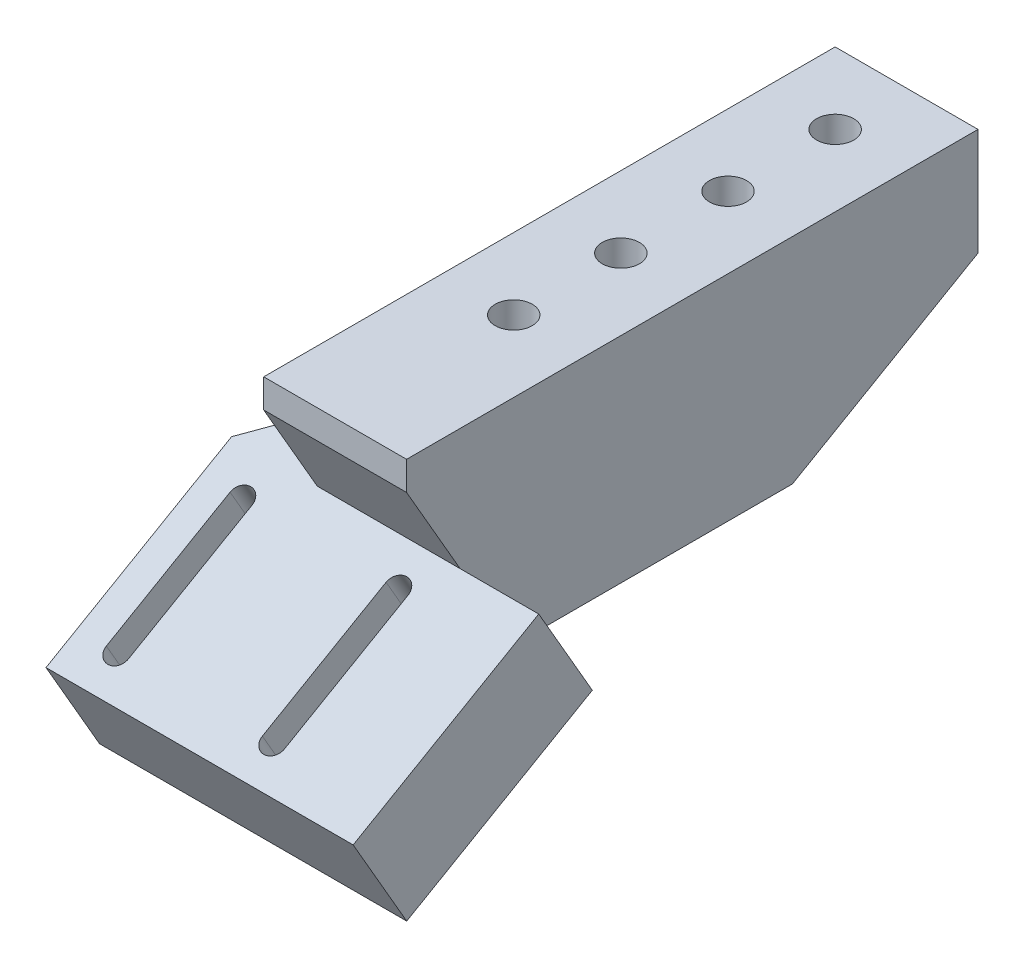
from build123d import *

# Parameters (mm, degrees)
SKETCH1_W           = 80
SKETCH1_H           = 30
BOSS_EXTRUDE1_DEPTH = 20
CHAMFER1_SIZE       = 15
CHAMFER1_SIZE2      = 25.980762114
SKETCH2_W           = 43
SKETCH2_H           = 15
BOSS_EXTRUDE2_DEPTH = 30
CUT_EXTRUDE1_REACH  = 75.891
CUT_EXTRUDE2_DEPTH  = 3
SKETCH5_W           = 12
SKETCH5_H           = 12
BOSS_EXTRUDE3_DEPTH = 15
CHAMFER2_SIZE       = 12
CUT_EXTRUDE3_REACH  = 75.103
SKETCH6_R           = 2.6
SKETCH7_R           = 5.5
CUT_EXTRUDE4_DEPTH  = 20
CHAMFER3_SIZE       = 15
CHAMFER3_SIZE_2     = 25.980762114


# Some blends are built 0.0001 mm under size
with BuildPart() as part:
    # Sketch1 → Boss-Extrude1 (new body)
    with BuildSketch(Plane(origin=(0, 0, 0), x_dir=(0, 0, -1), z_dir=(1, 0, 0))):
        Rectangle(SKETCH1_W, SKETCH1_H)
    extrude(amount=-BOSS_EXTRUDE1_DEPTH)

    # Chamfer1
    chamfer1_edges = [part.edges().sort_by_distance(p)[0] for p in [
        (-10, -15, 40),
    ]]
    chamfer1_side = [part.faces().sort_by_distance(p)[0] for p in [
        (-10, -15, 0),
    ]]
    chamfer(chamfer1_edges, length=CHAMFER1_SIZE, length2=CHAMFER1_SIZE2, reference=chamfer1_side[0])

    # Sketch2 → Boss-Extrude2 (add)
    with BuildSketch(Plane(origin=(0, -14.575317547, 25.245190528), x_dir=(1, 0, 0), z_dir=(0, -0.5000000000000012, 0.866025403784438))):
        with Locations((-10.5, 7.009618943)):
            Rectangle(SKETCH2_W, SKETCH2_H)
    extrude(amount=BOSS_EXTRUDE2_DEPTH)

    # Sketch3 → Cut-Extrude1 (cut, up to next)
    with BuildSketch(Plane(origin=(0, 12.565698604, 7.254809472), x_dir=(1, 0, 0), z_dir=(0, 0.8660254037844378, 0.5000000000000013)), mode=Mode.PRIVATE) as cut_extrude1_sk1:
        with BuildLine():
            Line((-24.78, -34.150635095), (-24.78, -54.150635095))
            ThreePointArc((-24.78, -54.150635095), (-26.33, -55.700635095), (-27.88, -54.150635095))
            Line((-27.88, -54.150635095), (-27.88, -34.150635095))
            ThreePointArc((-27.88, -34.150635095), (-26.33, -32.600635095), (-24.78, -34.150635095))
        make_face()
    cut_extrude1_tool1 = extrude(cut_extrude1_sk1.sketch, amount=-CUT_EXTRUDE1_REACH, mode=Mode.PRIVATE) & part.part
    # Sketch3 → Cut-Extrude1 (cut, up to next)
    with BuildSketch(Plane(origin=(0, 12.565698604, 7.254809472), x_dir=(1, 0, 0), z_dir=(0, 0.8660254037844378, 0.5000000000000013)), mode=Mode.PRIVATE) as cut_extrude1_sk2:
        with BuildLine():
            Line((-2.94, -34.150635095), (-2.94, -54.150635095))
            ThreePointArc((-2.94, -54.150635095), (-4.49, -55.700635095), (-6.04, -54.150635095))
            Line((-6.04, -54.150635095), (-6.04, -34.150635095))
            ThreePointArc((-6.04, -34.150635095), (-4.49, -32.600635095), (-2.94, -34.150635095))
        make_face()
    cut_extrude1_tool2 = extrude(cut_extrude1_sk2.sketch, amount=-CUT_EXTRUDE1_REACH, mode=Mode.PRIVATE) & part.part
    add(cut_extrude1_tool1.solids().sort_by_distance((-26.33, -9.509619, 45.490381))[0], mode=Mode.SUBTRACT)
    add(cut_extrude1_tool2.solids().sort_by_distance((-4.49, -9.509619, 45.490381))[0], mode=Mode.SUBTRACT)

    # Sketch4 → Cut-Extrude2 (cut)
    with BuildSketch(Plane(origin=(0, -0.424682453, -0.245190528), x_dir=(1, 0, 0), z_dir=(0, -0.8660254037844379, -0.5000000000000013))):
        with BuildLine():
            Line((-23.58, 54.150635095), (-23.58, 34.150635095))
            ThreePointArc((-23.58, 34.150635095), (-26.33, 31.400635095), (-29.08, 34.150635095))
            Line((-29.08, 34.150635095), (-29.08, 54.150635095))
            ThreePointArc((-29.08, 54.150635095), (-26.33, 56.900635095), (-23.58, 54.150635095))
        make_face()
        with BuildLine():
            Line((-1.74, 54.150635095), (-1.74, 34.150635095))
            ThreePointArc((-1.74, 34.150635095), (-4.49, 31.400635095), (-7.24, 34.150635095))
            Line((-7.24, 34.150635095), (-7.24, 54.150635095))
            ThreePointArc((-7.24, 54.150635095), (-4.49, 56.900635095), (-1.74, 54.150635095))
        make_face()
    extrude(amount=-CUT_EXTRUDE2_DEPTH, mode=Mode.SUBTRACT)

    # Sketch5 → Boss-Extrude3 (add)
    with BuildSketch(Plane(origin=(0, 12.565698604, 7.254809472), x_dir=(1, 0, 0), z_dir=(0, 0.8660254037844378, 0.5000000000000013))):
        with Locations((-26, -23.150635095)):
            Rectangle(SKETCH5_W, SKETCH5_H)
    extrude(amount=-BOSS_EXTRUDE3_DEPTH)

    # Chamfer2
    chamfer2_edges = [part.edges().sort_by_distance(p)[0] for p in [
        (-32, -2.504809472, 18.357695155),
    ]]
    chamfer(chamfer2_edges, length=CHAMFER2_SIZE - 0.0001)  # a hair under: the kernel refuses the full size

    # Sketch6 → Cut-Extrude3 (cut, up to next)
    with BuildSketch(Plane.XZ.offset(15), mode=Mode.PRIVATE) as cut_extrude3_sk1:
        with Locations(Location((-10, -30, 0), (0, 0, 270))):
            Circle(SKETCH6_R)
    cut_extrude3_tool1 = extrude(cut_extrude3_sk1.sketch, amount=-CUT_EXTRUDE3_REACH, mode=Mode.PRIVATE) & part.part
    # Sketch6 → Cut-Extrude3 (cut, up to next)
    with BuildSketch(Plane.XZ.offset(15), mode=Mode.PRIVATE) as cut_extrude3_sk2:
        with Locations(Location((-10, -15, 0), (0, 0, 270))):
            Circle(SKETCH6_R)
    cut_extrude3_tool2 = extrude(cut_extrude3_sk2.sketch, amount=-CUT_EXTRUDE3_REACH, mode=Mode.PRIVATE) & part.part
    # Sketch6 → Cut-Extrude3 (cut, up to next)
    with BuildSketch(Plane.XZ.offset(15), mode=Mode.PRIVATE) as cut_extrude3_sk3:
        with Locations(Location((-10, 0, 0), (0, 0, 270))):
            Circle(SKETCH6_R)
    cut_extrude3_tool3 = extrude(cut_extrude3_sk3.sketch, amount=-CUT_EXTRUDE3_REACH, mode=Mode.PRIVATE) & part.part
    # Sketch6 → Cut-Extrude3 (cut, up to next)
    with BuildSketch(Plane.XZ.offset(15), mode=Mode.PRIVATE) as cut_extrude3_sk4:
        with Locations(Location((-10, 15, 0), (0, 0, 270))):
            Circle(SKETCH6_R)
    cut_extrude3_tool4 = extrude(cut_extrude3_sk4.sketch, amount=-CUT_EXTRUDE3_REACH, mode=Mode.PRIVATE) & part.part
    add(cut_extrude3_tool1.solids().sort_by_distance((-10, -15, -30))[0], mode=Mode.SUBTRACT)
    add(cut_extrude3_tool2.solids().sort_by_distance((-10, -15, -15))[0], mode=Mode.SUBTRACT)
    add(cut_extrude3_tool3.solids().sort_by_distance((-10, -15, 0))[0], mode=Mode.SUBTRACT)
    add(cut_extrude3_tool4.solids().sort_by_distance((-10, -15, 15))[0], mode=Mode.SUBTRACT)

    # Sketch7 → Cut-Extrude4 (cut)
    with BuildSketch(Plane.XZ.offset(15)):
        with Locations(Location((-10, 15, 0), (0, 0, 270))):
            Circle(SKETCH7_R)
        with Locations(Location((-10, 0, 0), (0, 0, 270))):
            Circle(SKETCH7_R)
        with Locations(Location((-10, -15, 0), (0, 0, 270))):
            Circle(SKETCH7_R)
        with Locations(Location((-10, -30, 0), (0, 0, 270))):
            Circle(SKETCH7_R)
    extrude(amount=-CUT_EXTRUDE4_DEPTH, mode=Mode.SUBTRACT)

    # Chamfer3
    # the kernel refuses this chamfer: 25.980762114, 15 mm, written as the material it takes off along each edge
    with BuildSketch(Plane(origin=(67.214459559, -15, -40), x_dir=(0, 0.9983227437537926, -0.057893862402671366), z_dir=(-1, 0, 0))) as chamfer3_piece_1:
        Polygon((CHAMFER3_SIZE * 0.998322743754, -CHAMFER3_SIZE * 0.0578938624027), (-CHAMFER3_SIZE_2 * 0.0578938624016, -CHAMFER3_SIZE_2 * 0.998322743736), (0, 0), align=None)
    extrude(amount=154.428919118, mode=Mode.SUBTRACT)


solid = part.part
